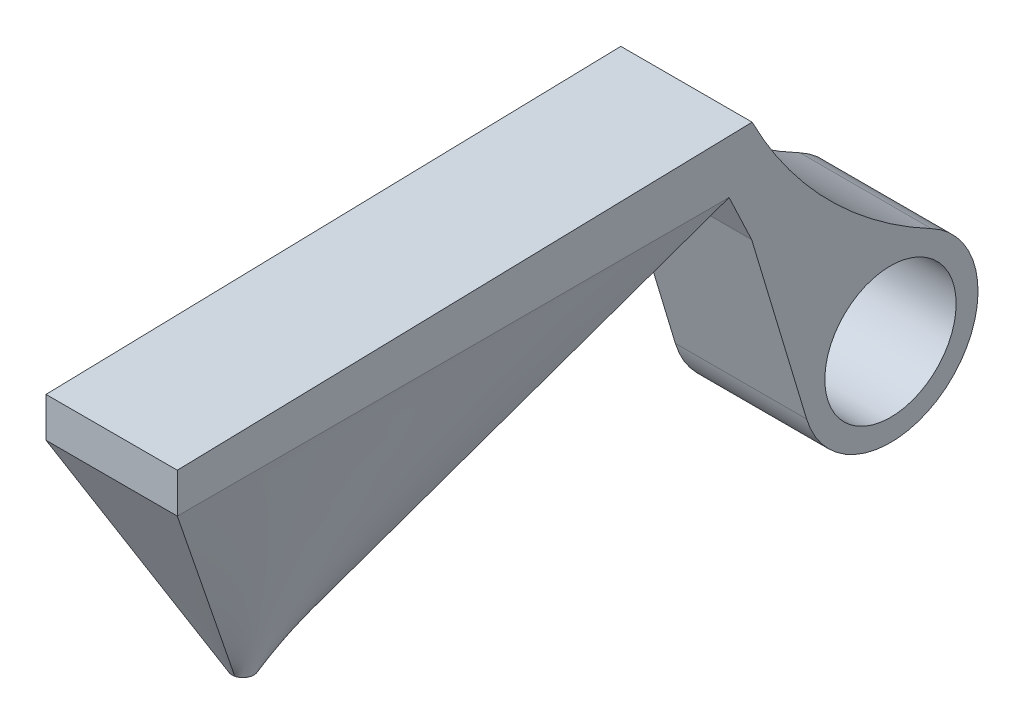
from build123d import *

# Parameters (mm, degrees)
SKETCH8_R           = 2
SKETCH8_R_2         = 1.5
BOSS_EXTRUDE3_DEPTH = 3


with BuildPart() as part:
    # Sketch8 → Boss-Extrude3 (new body)
    # profile 1 of 2: a face of its own
    with BuildSketch(Plane(origin=(0, 0, 0), x_dir=(0, 0, -1), z_dir=(1, 0, 0))):
        with BuildLine():
            Line((13.132863069, 0.320027848), (0, 0))
            Line((0, 0), (0, -0.907670556))
            Line((0, -0.907670556), (7.174444166, -0.907670556))
            Line((7.174444166, -0.907670556), (12.605766771, -0.907670556))
            Line((12.605766771, -0.907670556), (13.12184584, -1.999779955))
            Line((13.12184584, -1.999779955), (14.377901927, -6.177963459))
            ThreePointArc((14.377901927, -6.177963459), (15.022692005, -4.057588727), (17.227616297, -3.83386543))
            ThreePointArc((17.227616297, -3.83386543), (14.859483295, -2.073108487), (13.132863069, 0.320027848))
        make_face()
    # profile 2 of 2: a face of its own
    with BuildSketch(Plane(origin=(0, 0, 0), x_dir=(0, 0, -1), z_dir=(1, 0, 0))):
        with Locations((16.293226017, -5.602173889)):
            Circle(SKETCH8_R)
        with Locations((16.293226017, -5.602173889)):
            Circle(SKETCH8_R_2, mode=Mode.SUBTRACT)
    extrude(amount=BOSS_EXTRUDE3_DEPTH)


with BuildPart() as body_2:
    # Loft2: read off the stored shape, not the designer's step
    # Loft2: loft between two sections, ruled curve by curve
    loft2_from = [
        Edge.make_bspline([(1.442119938, -6.177963459, -2.756792479), (1.460889093, -6.177963459, -2.752325677), (1.480444547, -6.177963459, -2.750092276), (1.519555453, -6.177963459, -2.750092276), (1.539110907, -6.177963459, -2.752325677), (1.557880062, -6.177963459, -2.756792479)], [0, 0, 0, 0, 0.5, 0.5, 1, 1, 1, 1], 3),
        Edge.make_bspline([(1.557880062, -6.177963459, -2.756792479), (1.597313328, -6.177963459, -2.766177056), (1.643612327, -6.177963459, -2.787589475), (1.721437888, -6.177963459, -2.870740595), (1.75, -6.177963459, -2.934171465), (1.75, -6.177963459, -3.065828535), (1.721437888, -6.177963459, -3.129259405), (1.643612327, -6.177963459, -3.212410525), (1.597313328, -6.177963459, -3.233822944), (1.557880062, -6.177963459, -3.243207521)], [0, 0, 0, 0, 0.25, 0.25, 0.5, 0.5, 0.75, 0.75, 1, 1, 1, 1], 3),
        Edge.make_bspline([(1.442119938, -6.177963459, -3.243207521), (1.402686672, -6.177963459, -3.233822944), (1.356387673, -6.177963459, -3.212410525), (1.278562112, -6.177963459, -3.129259405), (1.25, -6.177963459, -3.065828535), (1.25, -6.177963459, -2.934171465), (1.278562112, -6.177963459, -2.870740595), (1.356387673, -6.177963459, -2.787589475), (1.402686672, -6.177963459, -2.766177056), (1.442119938, -6.177963459, -2.756792479)], [0, 0, 0, 0, 0.25, 0.25, 0.5, 0.5, 0.75, 0.75, 1, 1, 1, 1], 3),
        Edge.make_bspline([(1.557880062, -6.177963459, -3.243207521), (1.539110907, -6.177963459, -3.247674323), (1.519555453, -6.177963459, -3.249907724), (1.480444547, -6.177963459, -3.249907724), (1.460889093, -6.177963459, -3.247674323), (1.442119938, -6.177963459, -3.243207521)], [0, 0, 0, 0, 0.5, 0.5, 1, 1, 1, 1], 3),
    ]
    loft2_to = [
        Edge.make_bspline([(0, -0.907670556, 0), (0.5, -0.907670556, 0), (1, -0.907670556, 0), (2, -0.907670556, 0), (2.5, -0.907670556, 0), (3, -0.907670556, 0)], [0, 0, 0, 0, 0.5, 0.5, 1, 1, 1, 1], 3),
        Edge.make_bspline([(3, -0.907670556, 0), (3, -0.907670556, -1.050480564), (3, -0.907670556, -2.100961129), (3, -0.907670556, -4.201922257), (3, -0.907670556, -5.252402821), (3, -0.907670556, -7.35336395), (3, -0.907670556, -8.403844514), (3, -0.907670556, -10.504805643), (3, -0.907670556, -11.555286207), (3, -0.907670556, -12.605766771)], [0, 0, 0, 0, 0.25, 0.25, 0.5, 0.5, 0.75, 0.75, 1, 1, 1, 1], 3),
        Edge.make_bspline([(0, -0.907670556, -12.605766771), (0, -0.907670556, -11.555286207), (0, -0.907670556, -10.504805643), (0, -0.907670556, -8.403844514), (0, -0.907670556, -7.35336395), (0, -0.907670556, -5.252402821), (0, -0.907670556, -4.201922257), (0, -0.907670556, -2.100961129), (0, -0.907670556, -1.050480564), (0, -0.907670556, 0)], [0, 0, 0, 0, 0.25, 0.25, 0.5, 0.5, 0.75, 0.75, 1, 1, 1, 1], 3),
        Edge.make_bspline([(3, -0.907670556, -12.605766771), (2.5, -0.907670556, -12.605766771), (2, -0.907670556, -12.605766771), (1, -0.907670556, -12.605766771), (0.5, -0.907670556, -12.605766771), (0, -0.907670556, -12.605766771)], [0, 0, 0, 0, 0.5, 0.5, 1, 1, 1, 1], 3),
    ]
    loft2 = Solid(Shell([*[Face.make_surface_from_curves(loft2_from[k], loft2_to[k]) for k in range(4)], Face(Wire(loft2_from)), Face(Wire(loft2_to))]))
    add(loft2)


solid = Compound([part.part, body_2.part])
